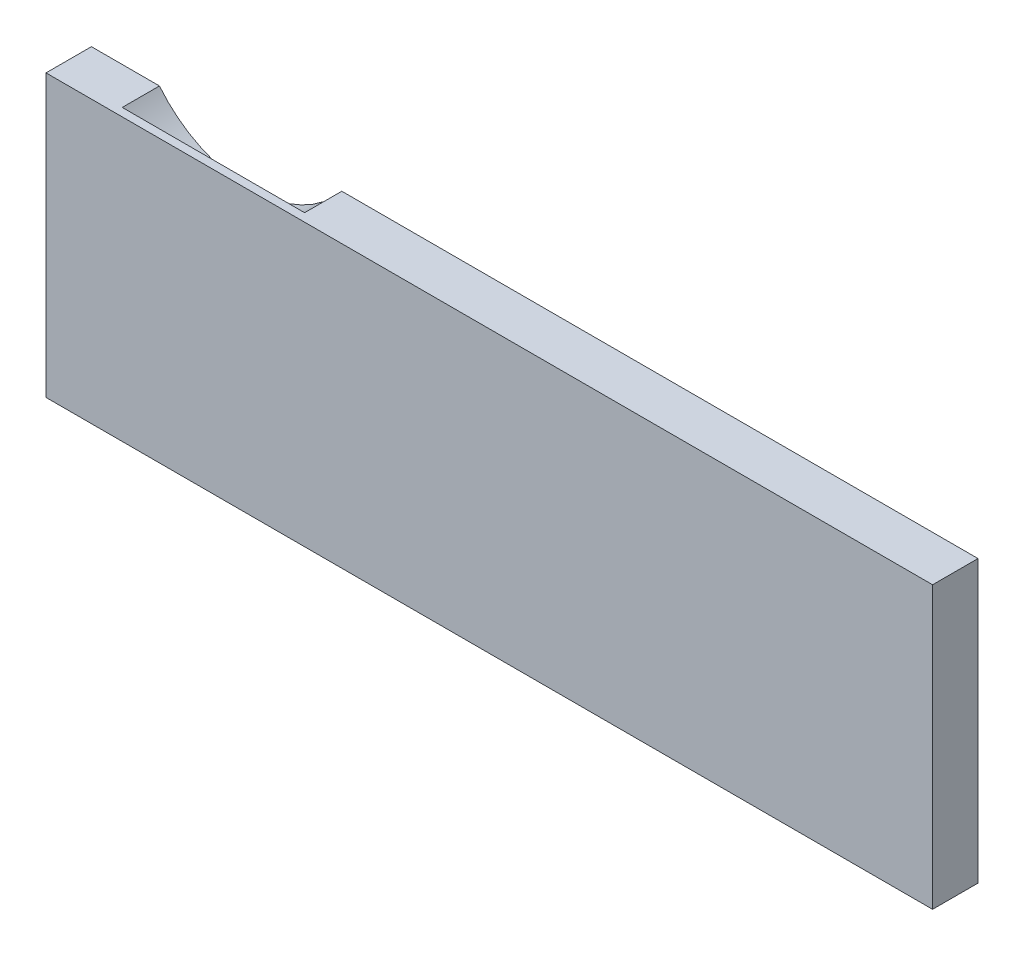
from build123d import *

# Parameters (mm, degrees)
SKETCH1_W           = 104.14
SKETCH1_H           = 33.02
BOSS_EXTRUDE1_DEPTH = 5.334
CAVITY1_DEPTH       = 4.3688
CAVITY1_2_OUTLINE_R = 2.794
CAVITY1_2_DEPTH     = 0.7112


# Read off the part's stored shape, not the designer's step: Cavity1
with BuildPart() as part:
    # Sketch1 → Boss-Extrude1 (new body)
    with BuildSketch(Plane.XY):
        with Locations((52.07, 16.51)):
            Rectangle(SKETCH1_W, SKETCH1_H)
    extrude(amount=BOSS_EXTRUDE1_DEPTH)

    # Cavity1 outline → Cavity1 (cut)
    with BuildSketch(Plane.XY):
        with BuildLine():
            ThreePointArc((7.993160963, 33.02), (18.702187299, 27.889223026), (29.411213634, 33.02))
            Line((29.411213634, 33.02), (7.993160963, 33.02))
        make_face()
    extrude(amount=CAVITY1_DEPTH, mode=Mode.SUBTRACT)

    # Cavity1 2 outline → Cavity1 2 (cut)
    with BuildSketch(Plane.XY):
        with Locations((64.319453414, 20.142181246)):
            Circle(CAVITY1_2_OUTLINE_R)
    extrude(amount=CAVITY1_2_DEPTH, mode=Mode.SUBTRACT)


solid = part.part
